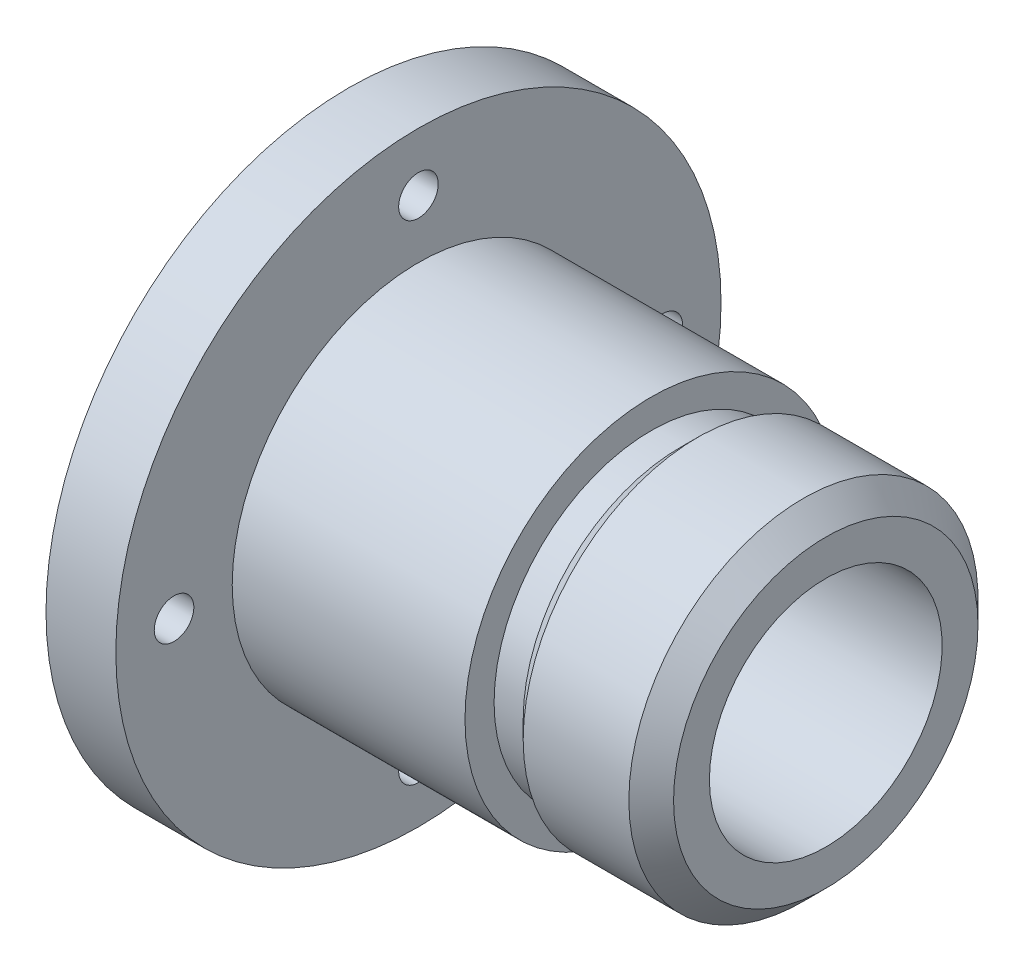
from build123d import *

# Parameters (mm, degrees)
CBORE_FOR_M3_HEX_SOCKET_HEAD_CAP_SCREW1_D           = 3.4
CBORE_FOR_M3_HEX_SOCKET_HEAD_CAP_SCREW1_CBORE_D     = 6.5
CBORE_FOR_M3_HEX_SOCKET_HEAD_CAP_SCREW1_CBORE_DEPTH = 3.4
F_20_0MM_DOWEL_HOLE1_D                              = 20


# Read off the part's stored shape, not the designer's step: M30 Machine Threads Stud1
with BuildPart() as part:
    # Sketch1 → Revolve1 (revolve)
    with BuildSketch(Plane.XY, mode=Mode.PRIVATE) as revolve1_sk:
        Polygon((0, 0), (41, 0), (41, 16), (6, 16), (6, 26), (0, 26), align=None)
    revolve(revolve1_sk.sketch.rotate(Axis((0, 0, 0), (1, 0, 0)), 90), axis=Axis((0, 0, 0), (1, 0, 0)))

    # M30 Machine Threads Stud1 outline → M30 Machine Threads Stud1 (revolve, cut)
    with BuildSketch(Plane.YX):
        Polygon((16, 41), (13.079, 41), (15, 39.079), (15, 26), (16, 26), align=None)
    revolve(axis=Axis((0, 0, 0), (1, 0, 0)), mode=Mode.SUBTRACT)

    # CBORE for M3 Hex Socket Head Cap Screw1 (through all)
    with Locations(Plane.ZY):
        with Locations((-21, 0), (0, 21), (21, 0), (0, -21)):
            CounterBoreHole(CBORE_FOR_M3_HEX_SOCKET_HEAD_CAP_SCREW1_D / 2, CBORE_FOR_M3_HEX_SOCKET_HEAD_CAP_SCREW1_CBORE_D / 2, CBORE_FOR_M3_HEX_SOCKET_HEAD_CAP_SCREW1_CBORE_DEPTH)

    # Ø20.0mm Dowel Hole1 (through all)
    with Locations(Plane.ZY):
        with Locations((0, 0)):
            Hole(F_20_0MM_DOWEL_HOLE1_D / 2)

    # Sketch9 → Cut-Revolve1 (revolve, cut)
    with BuildSketch(Plane.XY, mode=Mode.PRIVATE) as cut_revolve1_sk:
        Polygon((30, 15), (28.5, 13.5), (26, 13.5), (26, 15), align=None)
    revolve(cut_revolve1_sk.sketch.rotate(Axis((0, 0, 0), (1, 0, 0)), 90), axis=Axis((0, 0, 0), (1, 0, 0)), mode=Mode.SUBTRACT)


solid = part.part
